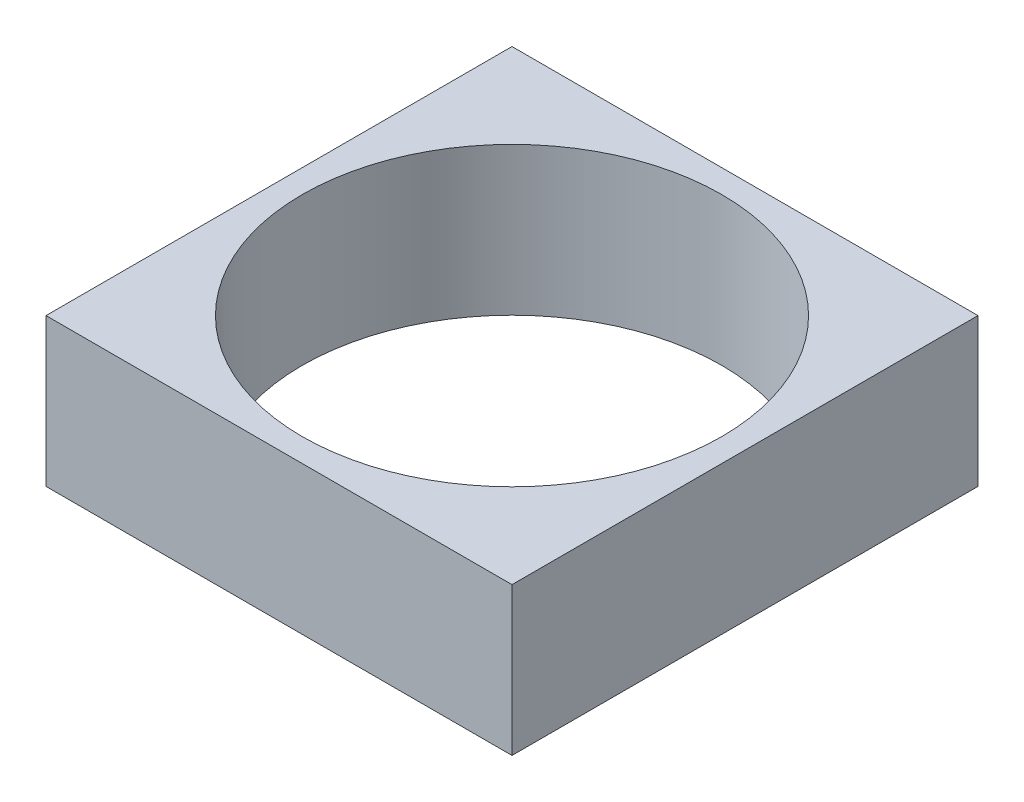
from build123d import *

# Parameters (mm, degrees)
SKETCH1_W           = 10
SKETCH1_H           = 10
SKETCH1_R           = 4.5
BOSS_EXTRUDE1_DEPTH = 3.175


with BuildPart() as part:
    # Sketch1 → Boss-Extrude1 (new body)
    with BuildSketch(Plane(origin=(0, 0, 0), x_dir=(1, 0, 0), z_dir=(0, 1, 0))):
        with Locations((5, -5)):
            Rectangle(SKETCH1_W, SKETCH1_H)
        with Locations((5, -5)):
            Circle(SKETCH1_R, mode=Mode.SUBTRACT)
    extrude(amount=BOSS_EXTRUDE1_DEPTH)


solid = part.part
